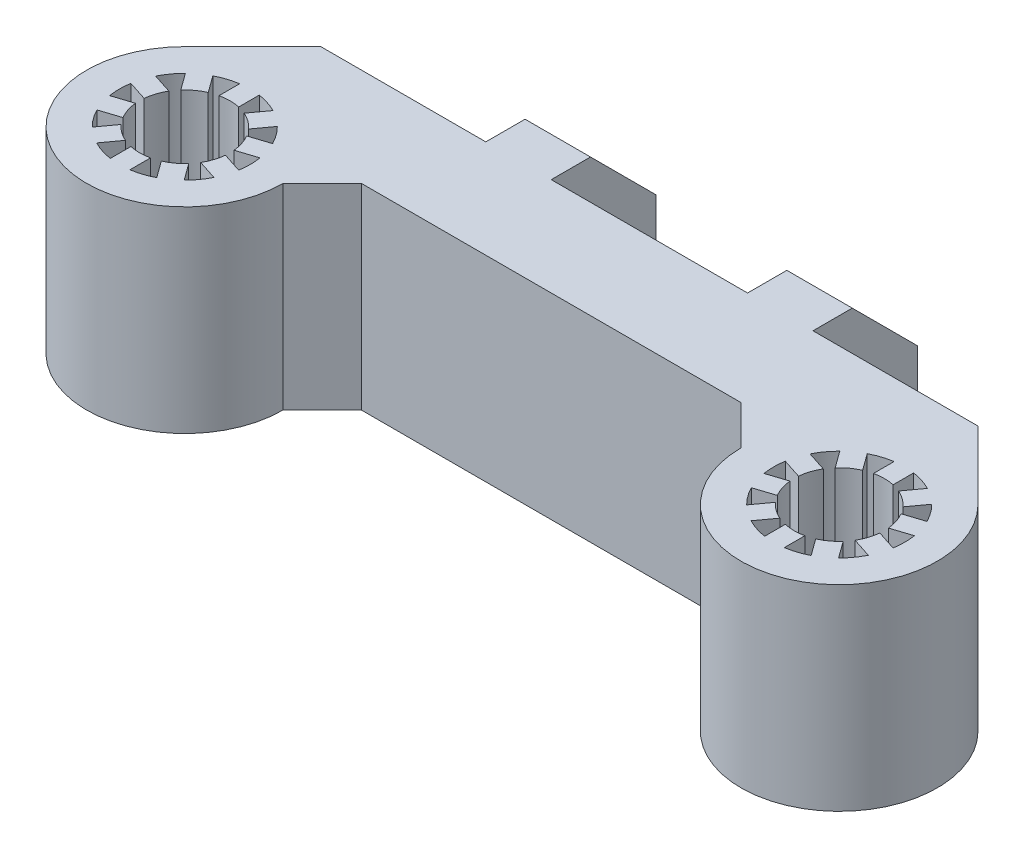
from build123d import *

# Parameters (mm, degrees)
SKETCH1_R           = 7.5
SKETCH1_R_2         = 5
SKETCH1_W           = 5
SKETCH1_H           = 8
BOSS_EXTRUDE1_DEPTH = 7.5
CHAMFER1_SIZE       = 5
SKETCH3_R           = 2
CUT_EXTRUDE1_DEPTH  = 15


with BuildPart() as part:
    # Sketch1 → Boss-Extrude1 (new, symmetric)
    # profile 1 of 26: a face of its own
    with BuildSketch(Plane(origin=(0, 0, 0), x_dir=(1, 0, 0), z_dir=(0, 1, 0))):
        with Locations((-25, 0)):
            Circle(SKETCH1_R)
        with Locations((-25, 0)):
            Circle(SKETCH1_R_2, mode=Mode.SUBTRACT)
    # profile 2 of 26: a face of its own
    with BuildSketch(Plane(origin=(0, 0, 0), x_dir=(1, 0, 0), z_dir=(0, 1, 0))):
        with BuildLine():
            Line((-27.97091213, 1.753904535), (-29.469718553, 2.240896263))
            ThreePointArc((-29.469718553, 2.240896263), (-29.755282581, 1.545084972), (-29.933244044, 0.814311488))
            Line((-29.933244044, 0.814311488), (-28.434437621, 0.32731976))
            ThreePointArc((-28.434437621, 0.32731976), (-28.281144981, 1.066108631), (-27.97091213, 1.753904535))
        make_face()
    # profile 3 of 26: a face of its own
    with BuildSketch(Plane(origin=(0, 0, 0), x_dir=(1, 0, 0), z_dir=(0, 1, 0))):
        with BuildLine():
            Line((-28.434437621, -0.32731976), (-29.933244044, -0.814311488))
            ThreePointArc((-29.933244044, -0.814311488), (-29.755282581, -1.545084972), (-29.469718553, -2.240896263))
            Line((-29.469718553, -2.240896263), (-27.97091213, -1.753904535))
            ThreePointArc((-27.97091213, -1.753904535), (-28.281144981, -1.066108631), (-28.434437621, -0.32731976))
        make_face()
    # profile 4 of 26: a face of its own
    with BuildSketch(Plane(origin=(0, 0, 0), x_dir=(1, 0, 0), z_dir=(0, 1, 0))):
        with BuildLine():
            Line((-27.586124674, -2.283519033), (-28.512437986, -3.558479928))
            ThreePointArc((-28.512437986, -3.558479928), (-27.938926261, -4.045084972), (-27.298912494, -4.440157806))
            Line((-27.298912494, -4.440157806), (-26.372599182, -3.165196911))
            ThreePointArc((-26.372599182, -3.165196911), (-27.02785912, -2.791108631), (-27.586124674, -2.283519033))
        make_face()
    # profile 5 of 26: a face of its own
    with BuildSketch(Plane(origin=(0, 0, 0), x_dir=(1, 0, 0), z_dir=(0, 1, 0))):
        with BuildLine():
            Line((-25.75, -3.367491648), (-25.75, -4.943429983))
            ThreePointArc((-25.75, -4.943429983), (-25, -5), (-24.25, -4.943429983))
            Line((-24.25, -4.943429983), (-24.25, -3.367491648))
            ThreePointArc((-24.25, -3.367491648), (-25, -3.45), (-25.75, -3.367491648))
        make_face()
    # profile 6 of 26: a face of its own
    with BuildSketch(Plane(origin=(0, 0, 0), x_dir=(1, 0, 0), z_dir=(0, 1, 0))):
        with BuildLine():
            ThreePointArc((-22.701087506, -4.440157806), (-22.061073739, -4.045084972), (-21.487562014, -3.558479928))
            Line((-21.487562014, -3.558479928), (-22.413875326, -2.283519033))
            ThreePointArc((-22.413875326, -2.283519033), (-22.97214088, -2.791108631), (-23.627400818, -3.165196911))
            Line((-23.627400818, -3.165196911), (-22.701087506, -4.440157806))
        make_face()
    # profile 7 of 26: a face of its own
    with BuildSketch(Plane(origin=(0, 0, 0), x_dir=(1, 0, 0), z_dir=(0, 1, 0))):
        with BuildLine():
            ThreePointArc((-20.530281447, -2.240896263), (-20.244717419, -1.545084972), (-20.066755956, -0.814311488))
            Line((-20.066755956, -0.814311488), (-21.565562379, -0.32731976))
            ThreePointArc((-21.565562379, -0.32731976), (-21.718855019, -1.066108631), (-22.02908787, -1.753904535))
            Line((-22.02908787, -1.753904535), (-20.530281447, -2.240896263))
        make_face()
    # profile 8 of 26: a face of its own
    with BuildSketch(Plane(origin=(0, 0, 0), x_dir=(1, 0, 0), z_dir=(0, 1, 0))):
        with BuildLine():
            ThreePointArc((-20.066755956, 0.814311488), (-20.244717419, 1.545084972), (-20.530281447, 2.240896263))
            Line((-20.530281447, 2.240896263), (-22.02908787, 1.753904535))
            ThreePointArc((-22.02908787, 1.753904535), (-21.718855019, 1.066108631), (-21.565562379, 0.32731976))
            Line((-21.565562379, 0.32731976), (-20.066755956, 0.814311488))
        make_face()
    # profile 9 of 26: a face of its own
    with BuildSketch(Plane(origin=(0, 0, 0), x_dir=(1, 0, 0), z_dir=(0, 1, 0))):
        with BuildLine():
            ThreePointArc((-21.487562014, 3.558479928), (-22.061073739, 4.045084972), (-22.701087506, 4.440157806))
            Line((-22.701087506, 4.440157806), (-23.627400818, 3.165196911))
            ThreePointArc((-23.627400818, 3.165196911), (-22.97214088, 2.791108631), (-22.413875326, 2.283519033))
            Line((-22.413875326, 2.283519033), (-21.487562014, 3.558479928))
        make_face()
    # profile 10 of 26: a face of its own
    with BuildSketch(Plane(origin=(0, 0, 0), x_dir=(1, 0, 0), z_dir=(0, 1, 0))):
        with BuildLine():
            ThreePointArc((-24.25, 4.943429983), (-25, 5), (-25.75, 4.943429983))
            Line((-25.75, 4.943429983), (-25.75, 3.367491648))
            ThreePointArc((-25.75, 3.367491648), (-25, 3.45), (-24.25, 3.367491648))
            Line((-24.25, 3.367491648), (-24.25, 4.943429983))
        make_face()
    # profile 11 of 26: a face of its own
    with BuildSketch(Plane(origin=(0, 0, 0), x_dir=(1, 0, 0), z_dir=(0, 1, 0))):
        with BuildLine():
            Line((-26.372599182, 3.165196911), (-27.298912494, 4.440157806))
            ThreePointArc((-27.298912494, 4.440157806), (-27.938926261, 4.045084972), (-28.512437986, 3.558479928))
            Line((-28.512437986, 3.558479928), (-27.586124674, 2.283519033))
            ThreePointArc((-27.586124674, 2.283519033), (-27.02785912, 2.791108631), (-26.372599182, 3.165196911))
        make_face()
    # profile 12 of 26: a face of its own
    with BuildSketch(Plane(origin=(0, 0, 0), x_dir=(1, 0, 0), z_dir=(0, 1, 0))):
        with BuildLine():
            Line((-25.106601718, 10.5), (-30.303300859, 5.303300859))
            ThreePointArc((-30.303300859, 5.303300859), (-22.129874257, 6.929096494), (-17.5, 0))
            Line((-17.5, 0), (-14.5, 3))
            Line((-14.5, 3), (0, 3))
            Line((0, 3), (0, 10.5))
            Line((0, 10.5), (-7.5, 10.5))
            Line((-7.5, 10.5), (-12.5, 10.5))
            Line((-12.5, 10.5), (-25.106601718, 10.5))
        make_face()
    # profile 13 of 26: a face of its own
    with BuildSketch(Plane(origin=(0, 0, 0), x_dir=(1, 0, 0), z_dir=(0, 1, 0))):
        with Locations((-10, 14.5)):
            Rectangle(SKETCH1_W, SKETCH1_H)
    # profile 14 of 26: a face of its own
    with BuildSketch(Plane(origin=(0, 0, 0), x_dir=(1, 0, 0), z_dir=(0, 1, 0))):
        with BuildLine():
            Line((0, 10.5), (0, 3))
            Line((0, 3), (14.5, 3))
            Line((14.5, 3), (17.5, 0))
            ThreePointArc((17.5, 0), (22.129874257, 6.929096494), (30.303300859, 5.303300859))
            Line((30.303300859, 5.303300859), (25.106601718, 10.5))
            Line((25.106601718, 10.5), (12.5, 10.5))
            Line((12.5, 10.5), (7.5, 10.5))
            Line((7.5, 10.5), (0, 10.5))
        make_face()
    # profile 15 of 26: a face of its own
    with BuildSketch(Plane(origin=(0, 0, 0), x_dir=(1, 0, 0), z_dir=(0, 1, 0))):
        with Locations((10, 14.5)):
            Rectangle(SKETCH1_W, SKETCH1_H)
    # profile 16 of 26: a face of its own
    with BuildSketch(Plane(origin=(0, 0, 0), x_dir=(1, 0, 0), z_dir=(0, 1, 0))):
        with Locations((25, 0)):
            Circle(SKETCH1_R)
        with Locations((25, 0)):
            Circle(SKETCH1_R_2, mode=Mode.SUBTRACT)
    # profile 17 of 26: a face of its own
    with BuildSketch(Plane(origin=(0, 0, 0), x_dir=(1, 0, 0), z_dir=(0, 1, 0))):
        with BuildLine():
            Line((25.75, 3.367491648), (25.75, 4.943429983))
            ThreePointArc((25.75, 4.943429983), (25, 5), (24.25, 4.943429983))
            Line((24.25, 4.943429983), (24.25, 3.367491648))
            ThreePointArc((24.25, 3.367491648), (25, 3.45), (25.75, 3.367491648))
        make_face()
    # profile 18 of 26: a face of its own
    with BuildSketch(Plane(origin=(0, 0, 0), x_dir=(1, 0, 0), z_dir=(0, 1, 0))):
        with BuildLine():
            Line((23.627400818, 3.165196911), (22.701087506, 4.440157806))
            ThreePointArc((22.701087506, 4.440157806), (22.061073739, 4.045084972), (21.487562014, 3.558479928))
            Line((21.487562014, 3.558479928), (22.413875326, 2.283519033))
            ThreePointArc((22.413875326, 2.283519033), (22.97214088, 2.791108631), (23.627400818, 3.165196911))
        make_face()
    # profile 19 of 26: a face of its own
    with BuildSketch(Plane(origin=(0, 0, 0), x_dir=(1, 0, 0), z_dir=(0, 1, 0))):
        with BuildLine():
            Line((22.02908787, 1.753904535), (20.530281447, 2.240896263))
            ThreePointArc((20.530281447, 2.240896263), (20.244717419, 1.545084972), (20.066755956, 0.814311488))
            Line((20.066755956, 0.814311488), (21.565562379, 0.32731976))
            ThreePointArc((21.565562379, 0.32731976), (21.718855019, 1.066108631), (22.02908787, 1.753904535))
        make_face()
    # profile 20 of 26: a face of its own
    with BuildSketch(Plane(origin=(0, 0, 0), x_dir=(1, 0, 0), z_dir=(0, 1, 0))):
        with BuildLine():
            Line((21.565562379, -0.32731976), (20.066755956, -0.814311488))
            ThreePointArc((20.066755956, -0.814311488), (20.244717419, -1.545084972), (20.530281447, -2.240896263))
            Line((20.530281447, -2.240896263), (22.02908787, -1.753904535))
            ThreePointArc((22.02908787, -1.753904535), (21.718855019, -1.066108631), (21.565562379, -0.32731976))
        make_face()
    # profile 21 of 26: a face of its own
    with BuildSketch(Plane(origin=(0, 0, 0), x_dir=(1, 0, 0), z_dir=(0, 1, 0))):
        with BuildLine():
            ThreePointArc((21.487562014, -3.558479928), (22.061073739, -4.045084972), (22.701087506, -4.440157806))
            Line((22.701087506, -4.440157806), (23.627400818, -3.165196911))
            ThreePointArc((23.627400818, -3.165196911), (22.97214088, -2.791108631), (22.413875326, -2.283519033))
            Line((22.413875326, -2.283519033), (21.487562014, -3.558479928))
        make_face()
    # profile 22 of 26: a face of its own
    with BuildSketch(Plane(origin=(0, 0, 0), x_dir=(1, 0, 0), z_dir=(0, 1, 0))):
        with BuildLine():
            ThreePointArc((24.25, -4.943429983), (25, -5), (25.75, -4.943429983))
            Line((25.75, -4.943429983), (25.75, -3.367491648))
            ThreePointArc((25.75, -3.367491648), (25, -3.45), (24.25, -3.367491648))
            Line((24.25, -3.367491648), (24.25, -4.943429983))
        make_face()
    # profile 23 of 26: a face of its own
    with BuildSketch(Plane(origin=(0, 0, 0), x_dir=(1, 0, 0), z_dir=(0, 1, 0))):
        with BuildLine():
            ThreePointArc((27.298912494, -4.440157806), (27.938926261, -4.045084972), (28.512437986, -3.558479928))
            Line((28.512437986, -3.558479928), (27.586124674, -2.283519033))
            ThreePointArc((27.586124674, -2.283519033), (27.02785912, -2.791108631), (26.372599182, -3.165196911))
            Line((26.372599182, -3.165196911), (27.298912494, -4.440157806))
        make_face()
    # profile 24 of 26: a face of its own
    with BuildSketch(Plane(origin=(0, 0, 0), x_dir=(1, 0, 0), z_dir=(0, 1, 0))):
        with BuildLine():
            ThreePointArc((29.469718553, -2.240896263), (29.755282581, -1.545084972), (29.933244044, -0.814311488))
            Line((29.933244044, -0.814311488), (28.434437621, -0.32731976))
            ThreePointArc((28.434437621, -0.32731976), (28.281144981, -1.066108631), (27.97091213, -1.753904535))
            Line((27.97091213, -1.753904535), (29.469718553, -2.240896263))
        make_face()
    # profile 25 of 26: a face of its own
    with BuildSketch(Plane(origin=(0, 0, 0), x_dir=(1, 0, 0), z_dir=(0, 1, 0))):
        with BuildLine():
            ThreePointArc((29.933244044, 0.814311488), (29.755282581, 1.545084972), (29.469718553, 2.240896263))
            Line((29.469718553, 2.240896263), (27.97091213, 1.753904535))
            ThreePointArc((27.97091213, 1.753904535), (28.281144981, 1.066108631), (28.434437621, 0.32731976))
            Line((28.434437621, 0.32731976), (29.933244044, 0.814311488))
        make_face()
    # profile 26 of 26: a face of its own
    with BuildSketch(Plane(origin=(0, 0, 0), x_dir=(1, 0, 0), z_dir=(0, 1, 0))):
        with BuildLine():
            Line((27.586124674, 2.283519033), (28.512437986, 3.558479928))
            ThreePointArc((28.512437986, 3.558479928), (27.938926261, 4.045084972), (27.298912494, 4.440157806))
            Line((27.298912494, 4.440157806), (26.372599182, 3.165196911))
            ThreePointArc((26.372599182, 3.165196911), (27.02785912, 2.791108631), (27.586124674, 2.283519033))
        make_face()
    extrude(amount=BOSS_EXTRUDE1_DEPTH, both=True)

    # Chamfer1
    chamfer1_edges = [part.edges().sort_by_distance(p)[0] for p in [
        (-10, 7.5, -18.5),
        (-10, -7.5, -18.5),
        (10, -7.5, -18.5),
        (10, 7.5, -18.5),
    ]]
    chamfer(chamfer1_edges, length=CHAMFER1_SIZE)

    # Sketch3 → Cut-Extrude1 (cut, symmetric)
    with BuildSketch(Plane(origin=(0, 0, 0), x_dir=(0, 0, -1), z_dir=(1, 0, 0))):
        with Locations((14.5, 0)):
            Circle(SKETCH3_R)
    extrude(amount=CUT_EXTRUDE1_DEPTH, both=True, mode=Mode.SUBTRACT)


solid = part.part
